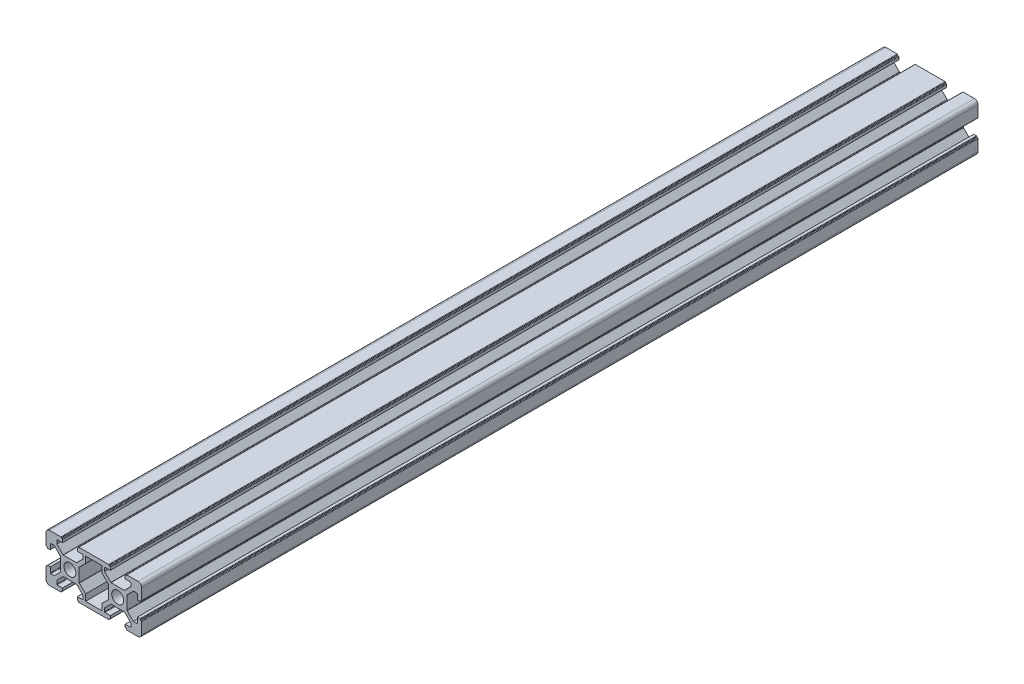
from build123d import *

# Parameters (mm, degrees)
BOSS_EXTRUDE1_DEPTH = 350
SKETCH2_R           = 2.5
CUT_EXTRUDE1_DEPTH  = 352.425667816


with BuildPart() as part:
    # Sketch1 → Boss-Extrude1 (new body)
    with BuildSketch(Plane.XY):
        with BuildLine():
            Line((-8.5, 10), (-3.8, 10))
            ThreePointArc((-3.8, 10), (-3.658578644, 9.941421356), (-3.6, 9.8))
            Line((-3.6, 9.8), (-3.6, 9.7))
            ThreePointArc((-3.6, 9.7), (-3.541421356, 9.558578644), (-3.4, 9.5))
            Line((-3.4, 9.5), (-3.3, 9.5))
            ThreePointArc((-3.3, 9.5), (-3.158578644, 9.441421356), (-3.1, 9.3))
            Line((-3.1, 9.3), (-3.1, 8.2))
            Line((-3.1, 8.2), (-5.3, 8.2))
            ThreePointArc((-5.3, 8.2), (-5.441421356, 8.141421356), (-5.5, 8))
            Line((-5.5, 8), (-5.5, 6.560660172))
            Line((-5.5, 6.560660172), (-2.897918472, 3.958578644))
            ThreePointArc((-2.897918472, 3.958578644), (-2.833033802, 3.915224093), (-2.756497116, 3.9))
            Line((-2.756497116, 3.9), (2.756497116, 3.9))
            ThreePointArc((2.756497116, 3.9), (2.833033802, 3.915224093), (2.897918472, 3.958578644))
            Line((2.897918472, 3.958578644), (5.5, 6.560660172))
            Line((5.5, 6.560660172), (5.5, 8))
            ThreePointArc((5.5, 8), (5.441421356, 8.141421356), (5.3, 8.2))
            Line((5.3, 8.2), (3.1, 8.2))
            Line((3.1, 8.2), (3.1, 9.3))
            ThreePointArc((3.1, 9.3), (3.158578644, 9.441421356), (3.3, 9.5))
            Line((3.3, 9.5), (3.4, 9.5))
            ThreePointArc((3.4, 9.5), (3.541421356, 9.558578644), (3.6, 9.7))
            Line((3.6, 9.7), (3.6, 9.8))
            ThreePointArc((3.6, 9.8), (3.658578644, 9.941421356), (3.8, 10))
            Line((3.8, 10), (8.5, 10))
            Line((8.5, 10), (11.5, 10))
            Line((11.5, 10), (16.2, 10))
            ThreePointArc((16.2, 10), (16.341421356, 9.941421356), (16.4, 9.8))
            Line((16.4, 9.8), (16.4, 9.7))
            ThreePointArc((16.4, 9.7), (16.458578644, 9.558578644), (16.6, 9.5))
            Line((16.6, 9.5), (16.7, 9.5))
            ThreePointArc((16.7, 9.5), (16.841421356, 9.441421356), (16.9, 9.3))
            Line((16.9, 9.3), (16.9, 8.2))
            Line((16.9, 8.2), (14.7, 8.2))
            ThreePointArc((14.7, 8.2), (14.558578644, 8.141421356), (14.5, 8))
            Line((14.5, 8), (14.5, 6.560660172))
            Line((14.5, 6.560660172), (17.102081528, 3.958578644))
            ThreePointArc((17.102081528, 3.958578644), (17.166966198, 3.915224093), (17.243502884, 3.9))
            Line((17.243502884, 3.9), (22.756497116, 3.9))
            ThreePointArc((22.756497116, 3.9), (22.833033802, 3.915224093), (22.897918472, 3.958578644))
            Line((22.897918472, 3.958578644), (25.5, 6.560660172))
            Line((25.5, 6.560660172), (25.5, 8))
            ThreePointArc((25.5, 8), (25.441421356, 8.141421356), (25.3, 8.2))
            Line((25.3, 8.2), (23.1, 8.2))
            Line((23.1, 8.2), (23.1, 9.3))
            ThreePointArc((23.1, 9.3), (23.158578644, 9.441421356), (23.3, 9.5))
            Line((23.3, 9.5), (23.4, 9.5))
            ThreePointArc((23.4, 9.5), (23.541421356, 9.558578644), (23.6, 9.7))
            Line((23.6, 9.7), (23.6, 9.8))
            ThreePointArc((23.6, 9.8), (23.658578644, 9.941421356), (23.8, 10))
            Line((23.8, 10), (28.5, 10))
            ThreePointArc((28.5, 10), (29.560660172, 9.560660172), (30, 8.5))
            Line((30, 8.5), (30, 3.8))
            ThreePointArc((30, 3.8), (29.941421356, 3.658578644), (29.8, 3.6))
            Line((29.8, 3.6), (29.7, 3.6))
            ThreePointArc((29.7, 3.6), (29.558578644, 3.541421356), (29.5, 3.4))
            Line((29.5, 3.4), (29.5, 3.3))
            ThreePointArc((29.5, 3.3), (29.441421356, 3.158578644), (29.3, 3.1))
            Line((29.3, 3.1), (28.2, 3.1))
            Line((28.2, 3.1), (28.2, 5.3))
            ThreePointArc((28.2, 5.3), (28.141421356, 5.441421356), (28, 5.5))
            Line((28, 5.5), (26.560660172, 5.5))
            Line((26.560660172, 5.5), (23.958578644, 2.897918472))
            ThreePointArc((23.958578644, 2.897918472), (23.915224093, 2.833033802), (23.9, 2.756497116))
            Line((23.9, 2.756497116), (23.9, -2.756497116))
            ThreePointArc((23.9, -2.756497116), (23.915224093, -2.833033802), (23.958578644, -2.897918472))
            Line((23.958578644, -2.897918472), (26.560660172, -5.5))
            Line((26.560660172, -5.5), (28, -5.5))
            ThreePointArc((28, -5.5), (28.141421356, -5.441421356), (28.2, -5.3))
            Line((28.2, -5.3), (28.2, -3.1))
            Line((28.2, -3.1), (29.3, -3.1))
            ThreePointArc((29.3, -3.1), (29.441421356, -3.158578644), (29.5, -3.3))
            Line((29.5, -3.3), (29.5, -3.4))
            ThreePointArc((29.5, -3.4), (29.558578644, -3.541421356), (29.7, -3.6))
            Line((29.7, -3.6), (29.8, -3.6))
            ThreePointArc((29.8, -3.6), (29.941421356, -3.658578644), (30, -3.8))
            Line((30, -3.8), (30, -8.5))
            ThreePointArc((30, -8.5), (29.560660172, -9.560660172), (28.5, -10))
            Line((28.5, -10), (23.8, -10))
            ThreePointArc((23.8, -10), (23.658578644, -9.941421356), (23.6, -9.8))
            Line((23.6, -9.8), (23.6, -9.7))
            ThreePointArc((23.6, -9.7), (23.541421356, -9.558578644), (23.4, -9.5))
            Line((23.4, -9.5), (23.3, -9.5))
            ThreePointArc((23.3, -9.5), (23.158578644, -9.441421356), (23.1, -9.3))
            Line((23.1, -9.3), (23.1, -8.2))
            Line((23.1, -8.2), (25.3, -8.2))
            ThreePointArc((25.3, -8.2), (25.441421356, -8.141421356), (25.5, -8))
            Line((25.5, -8), (25.5, -6.560660172))
            Line((25.5, -6.560660172), (22.897918472, -3.958578644))
            ThreePointArc((22.897918472, -3.958578644), (22.833033802, -3.915224093), (22.756497116, -3.9))
            Line((22.756497116, -3.9), (17.243502884, -3.9))
            ThreePointArc((17.243502884, -3.9), (17.166966198, -3.915224093), (17.102081528, -3.958578644))
            Line((17.102081528, -3.958578644), (14.5, -6.560660172))
            Line((14.5, -6.560660172), (14.5, -8))
            ThreePointArc((14.5, -8), (14.558578644, -8.141421356), (14.7, -8.2))
            Line((14.7, -8.2), (16.9, -8.2))
            Line((16.9, -8.2), (16.9, -9.3))
            ThreePointArc((16.9, -9.3), (16.841421356, -9.441421356), (16.7, -9.5))
            Line((16.7, -9.5), (16.6, -9.5))
            ThreePointArc((16.6, -9.5), (16.458578644, -9.558578644), (16.4, -9.7))
            Line((16.4, -9.7), (16.4, -9.8))
            ThreePointArc((16.4, -9.8), (16.341421356, -9.941421356), (16.2, -10))
            Line((16.2, -10), (11.5, -10))
            Line((11.5, -10), (8.5, -10))
            Line((8.5, -10), (3.8, -10))
            ThreePointArc((3.8, -10), (3.658578644, -9.941421356), (3.6, -9.8))
            Line((3.6, -9.8), (3.6, -9.7))
            ThreePointArc((3.6, -9.7), (3.541421356, -9.558578644), (3.4, -9.5))
            Line((3.4, -9.5), (3.3, -9.5))
            ThreePointArc((3.3, -9.5), (3.158578644, -9.441421356), (3.1, -9.3))
            Line((3.1, -9.3), (3.1, -8.2))
            Line((3.1, -8.2), (5.3, -8.2))
            ThreePointArc((5.3, -8.2), (5.441421356, -8.141421356), (5.5, -8))
            Line((5.5, -8), (5.5, -6.560660172))
            Line((5.5, -6.560660172), (2.897918472, -3.958578644))
            ThreePointArc((2.897918472, -3.958578644), (2.833033802, -3.915224093), (2.756497116, -3.9))
            Line((2.756497116, -3.9), (-2.756497116, -3.9))
            ThreePointArc((-2.756497116, -3.9), (-2.833033802, -3.915224093), (-2.897918472, -3.958578644))
            Line((-2.897918472, -3.958578644), (-5.5, -6.560660172))
            Line((-5.5, -6.560660172), (-5.5, -8))
            ThreePointArc((-5.5, -8), (-5.441421356, -8.141421356), (-5.3, -8.2))
            Line((-5.3, -8.2), (-3.1, -8.2))
            Line((-3.1, -8.2), (-3.1, -9.3))
            ThreePointArc((-3.1, -9.3), (-3.158578644, -9.441421356), (-3.3, -9.5))
            Line((-3.3, -9.5), (-3.4, -9.5))
            ThreePointArc((-3.4, -9.5), (-3.541421356, -9.558578644), (-3.6, -9.7))
            Line((-3.6, -9.7), (-3.6, -9.8))
            ThreePointArc((-3.6, -9.8), (-3.658578644, -9.941421356), (-3.8, -10))
            Line((-3.8, -10), (-8.5, -10))
            ThreePointArc((-8.5, -10), (-9.560660172, -9.560660172), (-10, -8.5))
            Line((-10, -8.5), (-10, -3.8))
            ThreePointArc((-10, -3.8), (-9.941421356, -3.658578644), (-9.8, -3.6))
            Line((-9.8, -3.6), (-9.7, -3.6))
            ThreePointArc((-9.7, -3.6), (-9.558578644, -3.541421356), (-9.5, -3.4))
            Line((-9.5, -3.4), (-9.5, -3.3))
            ThreePointArc((-9.5, -3.3), (-9.441421356, -3.158578644), (-9.3, -3.1))
            Line((-9.3, -3.1), (-8.2, -3.1))
            Line((-8.2, -3.1), (-8.2, -5.3))
            ThreePointArc((-8.2, -5.3), (-8.141421356, -5.441421356), (-8, -5.5))
            Line((-8, -5.5), (-6.560660172, -5.5))
            Line((-6.560660172, -5.5), (-3.958578644, -2.897918472))
            ThreePointArc((-3.958578644, -2.897918472), (-3.915224093, -2.833033802), (-3.9, -2.756497116))
            Line((-3.9, -2.756497116), (-3.9, 2.756497116))
            ThreePointArc((-3.9, 2.756497116), (-3.915224093, 2.833033802), (-3.958578644, 2.897918472))
            Line((-3.958578644, 2.897918472), (-6.560660172, 5.5))
            Line((-6.560660172, 5.5), (-8, 5.5))
            ThreePointArc((-8, 5.5), (-8.141421356, 5.441421356), (-8.2, 5.3))
            Line((-8.2, 5.3), (-8.2, 3.1))
            Line((-8.2, 3.1), (-9.3, 3.1))
            ThreePointArc((-9.3, 3.1), (-9.441421356, 3.158578644), (-9.5, 3.3))
            Line((-9.5, 3.3), (-9.5, 3.4))
            ThreePointArc((-9.5, 3.4), (-9.558578644, 3.541421356), (-9.7, 3.6))
            Line((-9.7, 3.6), (-9.8, 3.6))
            ThreePointArc((-9.8, 3.6), (-9.941421356, 3.658578644), (-10, 3.8))
            Line((-10, 3.8), (-10, 8.5))
            ThreePointArc((-10, 8.5), (-9.560660172, 9.560660172), (-8.5, 10))
        make_face()
        with BuildLine():
            Line((3.9, 2.756497116), (3.9, -2.756497116))
            ThreePointArc((3.9, -2.756497116), (3.915224093, -2.833033802), (3.958578644, -2.897918472))
            Line((3.958578644, -2.897918472), (6.560660172, -5.5))
            Line((6.560660172, -5.5), (6.560660172, -8.2))
            Line((6.560660172, -8.2), (13.439339828, -8.2))
            Line((13.439339828, -8.2), (13.439339828, -5.5))
            Line((13.439339828, -5.5), (16.041421356, -2.897918472))
            ThreePointArc((16.041421356, -2.897918472), (16.084775907, -2.833033802), (16.1, -2.756497116))
            Line((16.1, -2.756497116), (16.1, 2.756497116))
            ThreePointArc((16.1, 2.756497116), (16.084775907, 2.833033802), (16.041421356, 2.897918472))
            Line((16.041421356, 2.897918472), (13.439339828, 5.5))
            Line((13.439339828, 5.5), (13.439339828, 8.2))
            Line((13.439339828, 8.2), (6.560660172, 8.2))
            Line((6.560660172, 8.2), (6.560660172, 5.5))
            Line((6.560660172, 5.5), (3.958578644, 2.897918472))
            ThreePointArc((3.958578644, 2.897918472), (3.915224093, 2.833033802), (3.9, 2.756497116))
        make_face(mode=Mode.SUBTRACT)
    extrude(amount=BOSS_EXTRUDE1_DEPTH)

    # Sketch2 → Cut-Extrude1 (cut, through all)
    with BuildSketch(Plane.XY.offset(350)):
        Circle(SKETCH2_R)
        with Locations((20, 0)):
            Circle(SKETCH2_R)
    extrude(amount=-CUT_EXTRUDE1_DEPTH, mode=Mode.SUBTRACT)


solid = part.part
